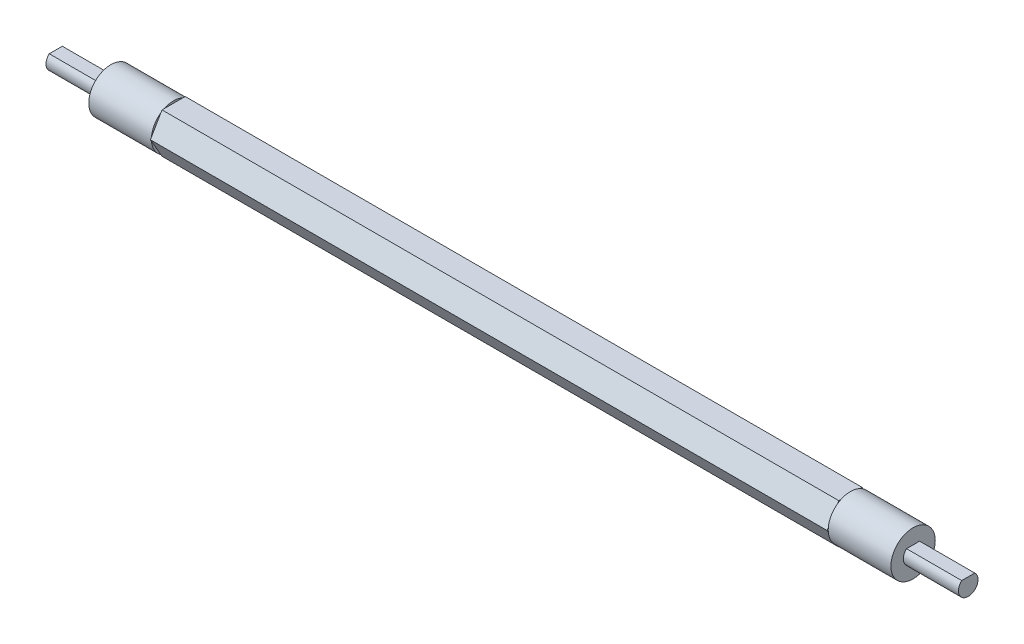
from build123d import *

# Parameters (mm, degrees)
BOSS_EXTRUDE1_DEPTH = 67.5
BOSS_EXTRUDE2_START = 67.5
SKETCH1_3_R         = 4.425
BOSS_EXTRUDE2_DEPTH = 12.5
BOSS_EXTRUDE4_DEPTH = 11


with BuildPart() as part:
    # Sketch1 → Boss-Extrude1 (new, symmetric)
    with BuildSketch(Plane(origin=(0, 0, 0), x_dir=(0, 0, -1), z_dir=(1, 0, 0))):
        Polygon((4.625, 0), (2.3125, 4.005367493), (-2.3125, 4.005367493), (-4.625, 0), (-2.3125, -4.005367493), (2.3125, -4.005367493), align=None)
    extrude(amount=BOSS_EXTRUDE1_DEPTH, both=True)

    # Sketch1<3> → Boss-Extrude2 (add)
    with BuildSketch(Plane(origin=(0, 0, 0), x_dir=(0, 0, -1), z_dir=(1, 0, 0)).offset(BOSS_EXTRUDE2_START)):
        Circle(SKETCH1_3_R)
    boss_extrude2 = extrude(amount=BOSS_EXTRUDE2_DEPTH)

    # Sketch4 → Boss-Extrude4 (add)
    with BuildSketch(Plane(origin=(80, 0, 0), x_dir=(0, 0, -1), z_dir=(1, 0, 0))):
        with BuildLine():
            Line((1.303840481, 1.45), (-1.303840481, 1.45))
            ThreePointArc((-1.303840481, 1.45), (-0.793728878, -1.78114976), (1.95, 0))
            ThreePointArc((1.95, 0), (1.78114976, 0.793728878), (1.303840481, 1.45))
        make_face()
    boss_extrude4 = extrude(amount=BOSS_EXTRUDE4_DEPTH)

    # Mirror2: Boss-Extrude2, Boss-Extrude4 across plane
    add(boss_extrude2.mirror(Plane(origin=(0, 0, 0), x_dir=(0, 0, 1), z_dir=(1, 0, 0))))
    add(boss_extrude4.mirror(Plane(origin=(0, 0, 0), x_dir=(0, 0, 1), z_dir=(1, 0, 0))))


solid = part.part
